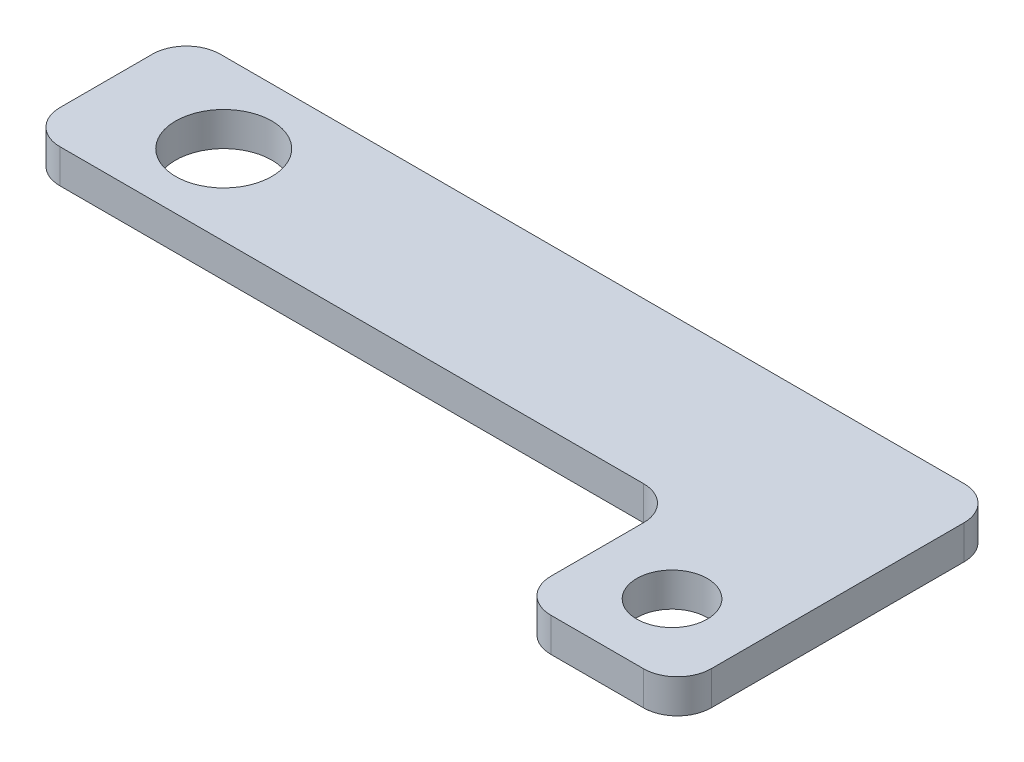
from build123d import *

# Parameters (mm, degrees)
BOSS_EXTRUDE1_DEPTH  = 3.175
M8_CLEARANCE_HOLE1_D = 9
M6_CLEARANCE_HOLE1_D = 6.6
FILLET1_R            = 3.175


with BuildPart() as part:
    # Sketch1 → Boss-Extrude1 (new body)
    with BuildSketch(Plane(origin=(0, 0, 0), x_dir=(1, 0, 0), z_dir=(0, 1, 0))):
        Polygon((6.05, -36.0812086), (56, -36.0812086), (56, -44.0812086), (56, -51.0812086), (71, -51.0812086), (71, -44.0812086), (71, -21.0812086), (6.05, -21.0812086), (-4.95, -21.0812086), (-4.95, -36.0812086), align=None)
    extrude(amount=-BOSS_EXTRUDE1_DEPTH)

    # M8 Clearance Hole1 (through all)
    with Locations(Plane(origin=(0, -3.175, 0), x_dir=(-1, 0, 0), z_dir=(0, -1, 0))):
        with Locations((-6.05, -28.5812086)):
            Hole(M8_CLEARANCE_HOLE1_D / 2)

    # M6 Clearance Hole1 (through all)
    with Locations(Plane(origin=(0, -3.175, 0), x_dir=(-1, 0, 0), z_dir=(0, -1, 0))):
        with Locations((-63.5, -44.0812086)):
            Hole(M6_CLEARANCE_HOLE1_D / 2)

    # Fillet1
    fillet1_edges = [part.edges().sort_by_distance(p)[0] for p in [
        (71, -1.5875, 21.0812086),
        (-4.95, -1.5875, 21.0812086),
        (-4.95, -1.5875, 36.0812086),
        (56, -1.5875, 36.0812086),
        (71, -1.5875, 51.0812086),
        (56, -1.5875, 51.0812086),
    ]]
    fillet(fillet1_edges, radius=FILLET1_R)


solid = part.part
